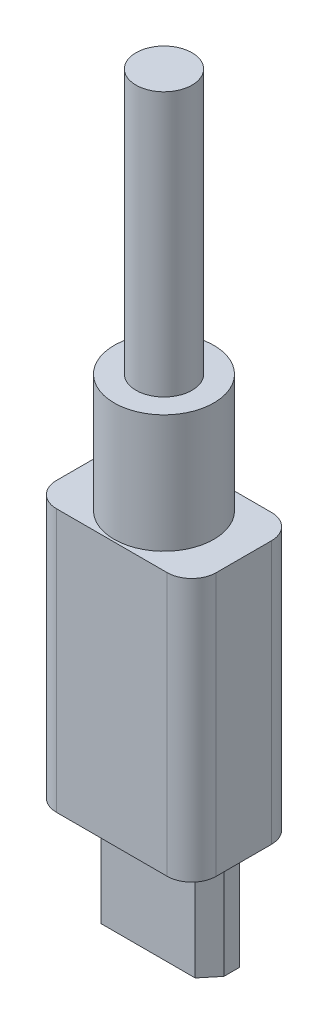
from build123d import *

# Parameters (mm, degrees)
BOSS_EXTRUDE1_DEPTH = 6.3
SKETCH2_W           = 9.11
SKETCH2_H           = 5.95
BOSS_EXTRUDE2_DEPTH = 15
FILLET1_R           = 1.4
SKETCH4_R           = 2.845
BOSS_EXTRUDE3_DEPTH = 6.74
SKETCH5_R           = 1.6
BOSS_EXTRUDE4_DEPTH = 15.078


with BuildPart() as part:
    # Sketch1 → Boss-Extrude1 (new body)
    with BuildSketch(Plane(origin=(0, 0, 0), x_dir=(1, 0, 0), z_dir=(0, 1, 0))):
        Polygon((-3.42, 0), (-2.68, -0.9), (2.68, -0.9), (3.42, 0), (3.42, 0.9), (-3.42, 0.9), align=None)
    extrude(amount=BOSS_EXTRUDE1_DEPTH)

    # Sketch2 → Boss-Extrude2 (add)
    with BuildSketch(Plane(origin=(0, 6.3, 0), x_dir=(1, 0, 0), z_dir=(0, 1, 0))):
        Rectangle(SKETCH2_W, SKETCH2_H)
    extrude(amount=BOSS_EXTRUDE2_DEPTH)

    # Fillet1
    fillet1_edges = [part.edges().sort_by_distance(p)[0] for p in [
        (4.555, 13.8, -2.975),
        (-4.555, 13.8, -2.975),
        (-4.555, 13.8, 2.975),
        (4.555, 13.8, 2.975),
    ]]
    fillet(fillet1_edges, radius=FILLET1_R)

    # Sketch4 → Boss-Extrude3 (add)
    with BuildSketch(Plane(origin=(0, 21.3, 0), x_dir=(1, 0, 0), z_dir=(0, 1, 0))):
        Circle(SKETCH4_R)
    extrude(amount=BOSS_EXTRUDE3_DEPTH)

    # Sketch5 → Boss-Extrude4 (add)
    with BuildSketch(Plane(origin=(0, 28.04, 0), x_dir=(1, 0, 0), z_dir=(0, 1, 0))):
        Circle(SKETCH5_R)
    extrude(amount=BOSS_EXTRUDE4_DEPTH)


solid = part.part
